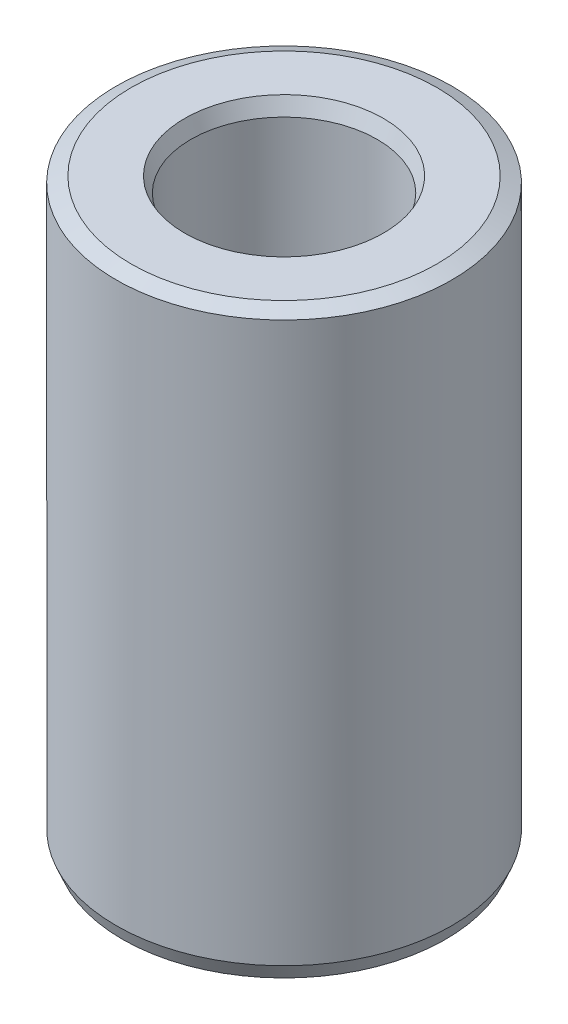
from build123d import *
from OCP.BRepFilletAPI import BRepFilletAPI_MakeChamfer

# Parameters (mm, degrees)
SKETCH1_R           = 52.5
BOSS_EXTRUDE1_DEPTH = 181.538281368
SKETCH2_R           = 29.133965717
CUT_EXTRUDE1_DEPTH  = 197.134259123
CHAMFER1_SIZE       = 1.958219198
CHAMFER1_SIZE2      = 4.694435549


with BuildPart() as part:
    # Sketch1 → Boss-Extrude1 (new body)
    with BuildSketch(Plane(origin=(0, 0, 0), x_dir=(1, 0, 0), z_dir=(0, 1, 0))):
        Circle(SKETCH1_R)
    extrude(amount=BOSS_EXTRUDE1_DEPTH)

    # Sketch2 → Cut-Extrude1 (cut, through all)
    with BuildSketch(Plane(origin=(0, 0, 0), x_dir=(1, 0, 0), z_dir=(0, 1, 0))):
        Circle(SKETCH2_R)
    extrude(amount=CUT_EXTRUDE1_DEPTH, mode=Mode.SUBTRACT)

    # Chamfer1: one chamfer whose edges measure the first distance from different faces: ONE call of the kernel's chamfer builder (chamfer() names one face for all edges)
    chamfer1_edges_1 = [part.edges().sort_by_distance(p)[0] for p in [
        (-29.133965717, 181.538281368, 0),
    ]]
    chamfer1_side_1 = [part.faces().sort_by_distance(p)[0] for p in [
        (-51.01507576, 181.538281368, 0),
    ]]
    chamfer1_edges_2 = [part.edges().sort_by_distance(p)[0] for p in [
        (-29.133965717, 0, 0),
    ]]
    chamfer1_side_2 = [part.faces().sort_by_distance(p)[0] for p in [
        (-29.133965717, 90.769140684, 0),
    ]]
    chamfer1_edges_3 = [part.edges().sort_by_distance(p)[0] for p in [
        (-52.5, 0, 0),
    ]]
    chamfer1_side_3 = [part.faces().sort_by_distance(p)[0] for p in [
        (-51.01507576, 0, 0),
    ]]
    chamfer1_edges_4 = [part.edges().sort_by_distance(p)[0] for p in [
        (-52.5, 181.538281368, 0),
    ]]
    chamfer1_side_4 = [part.faces().sort_by_distance(p)[0] for p in [
        (-52.5, 90.769140684, 0),
    ]]
    chamfer1 = BRepFilletAPI_MakeChamfer(part.part.solid().wrapped)
    for e in chamfer1_edges_1:
        chamfer1.Add(CHAMFER1_SIZE, CHAMFER1_SIZE2, e.wrapped, chamfer1_side_1[0].wrapped)  # the first distance lies on this face
    for e in chamfer1_edges_2:
        chamfer1.Add(CHAMFER1_SIZE, CHAMFER1_SIZE2, e.wrapped, chamfer1_side_2[0].wrapped)  # the first distance lies on this face
    for e in chamfer1_edges_3:
        chamfer1.Add(CHAMFER1_SIZE, CHAMFER1_SIZE2, e.wrapped, chamfer1_side_3[0].wrapped)  # the first distance lies on this face
    for e in chamfer1_edges_4:
        chamfer1.Add(CHAMFER1_SIZE, CHAMFER1_SIZE2, e.wrapped, chamfer1_side_4[0].wrapped)  # the first distance lies on this face
    add(Compound.cast(chamfer1.Shape()), mode=Mode.REPLACE)


solid = part.part
